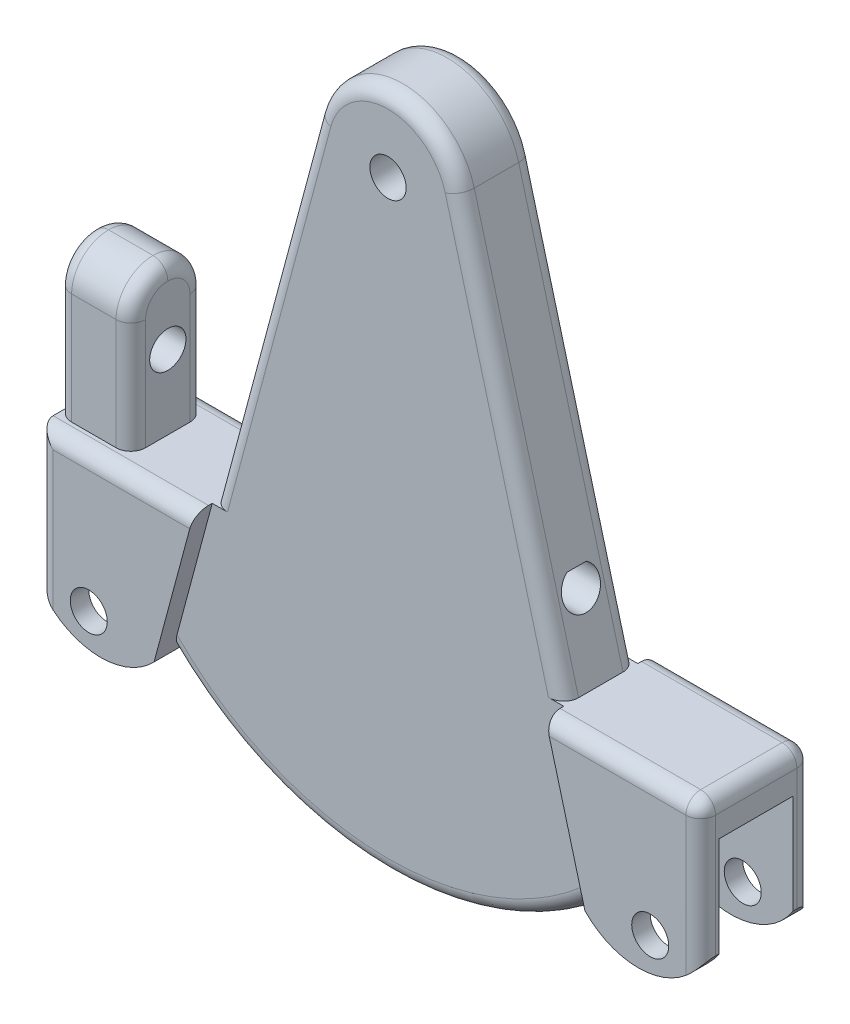
from build123d import *

# Parameters (mm, degrees)
SKETCH2_R           = 3.1115
BOSS_EXTRUDE1_DEPTH = 6.35
SKETCH3_R           = 3.1115
CUT_EXTRUDE1_DEPTH  = 12.7
CUT_EXTRUDE3_DEPTH  = 121.606183935
SKETCH9_R           = 3.175
BOSS_EXTRUDE2_DEPTH = 3.175
FILLET1_R           = 6.35
FILLET2_R           = 2.54


# Some blends are built 0.0001 mm under size
with BuildPart() as part:
    # Sketch2 → Boss-Extrude1 (new, symmetric)
    with BuildSketch(Plane.XY):
        with BuildLine():
            Line((26.67, -25.4), (44.565523217, 41.387001873))
            ThreePointArc((44.565523217, 41.387001873), (56.832781211, 50.8), (69.100039204, 41.387001873))
            Line((69.100039204, 41.387001873), (86.995562421, -25.4))
            Line((86.995562421, -25.4), (113.665562421, -25.4))
            Line((113.665562421, -25.4), (113.665562421, -31.75))
            Line((113.665562421, -31.75), (93.801471909, -50.8))
            ThreePointArc((93.801471909, -50.8), (56.832781211, -65.661893883), (19.864090512, -50.8))
            Line((19.864090512, -50.8), (0, -31.75))
            Line((0, -31.75), (0, 0))
            Line((0, 0), (12.7, 0))
            Line((12.7, 0), (12.7, -25.4))
            Line((12.7, -25.4), (26.67, -25.4))
        make_face()
        with Locations((56.832781211, 38.1)):
            Circle(SKETCH2_R, mode=Mode.SUBTRACT)
    extrude(amount=BOSS_EXTRUDE1_DEPTH, both=True)

    # Sketch3 → Cut-Extrude1 (cut)
    with BuildSketch(Plane.ZY):
        with Locations(Location((0, -12.7, 0), (0, 0, 270))):
            Circle(SKETCH3_R)
    extrude(amount=-CUT_EXTRUDE1_DEPTH, mode=Mode.SUBTRACT)

    # Sketch5 → Cut-Extrude3 (cut, through all)
    with BuildSketch(Plane(origin=(12.7, 0, 0), x_dir=(0, 0, -1), z_dir=(1, 0, 0))):
        with BuildLine():
            Line((1.651, -9.913948807), (-1.651, -9.913948807))
            ThreePointArc((-1.651, -9.913948807), (0, -15.9385), (1.651, -9.913948807))
        make_face()
    extrude(amount=CUT_EXTRUDE3_DEPTH, mode=Mode.SUBTRACT)

    # Sketch9 → Boss-Extrude2 (add)
    # profile 1 of 2: a face of its own
    with BuildSketch(Plane.XY.offset(6.35)):
        with BuildLine():
            Line((26.67, -25.4), (19.864090512, -50.8))
            ThreePointArc((19.864090512, -50.8), (9.459583385, -54.649013668), (0, -48.8537607))
            Line((0, -48.8537607), (0, -25.4))
            Line((0, -25.4), (26.67, -25.4))
        make_face()
        with Locations((8.660533834, -48.8537607)):
            Circle(SKETCH9_R, mode=Mode.SUBTRACT)
    # profile 2 of 2: a face of its own
    with BuildSketch(Plane.XY.offset(6.35)):
        with BuildLine():
            Line((113.665562421, -25.4), (86.995562421, -25.4))
            Line((86.995562421, -25.4), (93.801471909, -50.8))
            ThreePointArc((93.801471909, -50.8), (104.205979036, -54.649013668), (113.665562421, -48.8537607))
            Line((113.665562421, -48.8537607), (113.665562421, -25.4))
        make_face()
        with Locations(Location((105.005028588, -48.8537607, 0), (0, 0, 180))):
            Circle(SKETCH9_R, mode=Mode.SUBTRACT)
    boss_extrude2 = extrude(amount=BOSS_EXTRUDE2_DEPTH)

    # Mirror4: Boss-Extrude2 across plane
    add(boss_extrude2.mirror(Plane.XY))

    # Fillet1
    fillet1_edges = [part.edges().sort_by_distance(p)[0] for p in [
        (6.35, 0, -6.35),
        (6.35, 0, 6.35),
    ]]
    fillet(fillet1_edges, radius=FILLET1_R - 0.0001)  # a hair under: the kernel refuses the full size

    # Fillet2
    # the kernel refuses this fillet: 2.54 mm, written as the material it takes off along each edge
    with BuildSketch(Plane(origin=(111.125562421, -27.94, 6.985), x_dir=(0, 0, 1), z_dir=(0, 1, 0))) as fillet2_piece_1_section:
        Polygon((0, 0), (FILLET2_R * 1.02, 0), (FILLET2_R * 1.02, FILLET2_R * 1.02), (0, FILLET2_R * 1.02), align=None)
    fillet2_piece_1 = extrude(amount=FILLET2_R * 1.02, mode=Mode.PRIVATE)
    fillet2_piece_1 = fillet2_piece_1 - Plane(origin=(111.125562421, -27.94, 6.985), x_dir=(-0.7071067811865475, 0, -0.7071067811865475), z_dir=(0, 1, 0)) * Sphere(FILLET2_R, mode=Mode.PRIVATE)
    add(fillet2_piece_1, mode=Mode.SUBTRACT)
    with BuildSketch(Plane(origin=(111.125562421, -27.94, -6.985), x_dir=(0, 0, -1), z_dir=(0, 1, 0))) as fillet2_piece_2_section:
        Polygon((0, 0), (FILLET2_R * 1.02, 0), (FILLET2_R * 1.02, -FILLET2_R * 1.02), (0, -FILLET2_R * 1.02), align=None)
    fillet2_piece_2 = extrude(amount=FILLET2_R * 1.02, mode=Mode.PRIVATE)
    fillet2_piece_2 = fillet2_piece_2 - Plane(origin=(111.125562421, -27.94, -6.985), x_dir=(-0.7071067811865475, 0, 0.7071067811865475), z_dir=(0, 1, 0)) * Sphere(FILLET2_R, mode=Mode.PRIVATE)
    add(fillet2_piece_2, mode=Mode.SUBTRACT)
    with BuildSketch(Plane(origin=(12.7, -6.3499, -6.35), x_dir=(-1, 0, 0), z_dir=(0, -1, 0)), Plane(origin=(12.7, -6.3499, 6.35), x_dir=(0, 0, -1), z_dir=(0, -1, 0)), Plane(origin=(0, -25.4, 6.35), x_dir=(0, 0, -1), z_dir=(0, 1, 0)), Plane(origin=(0, -25.4, -6.35), x_dir=(1, 0, 0), z_dir=(0, 1, 0))) as fillet2_piece_3:
        with BuildLine():
            CenterArc((FILLET2_R, -FILLET2_R), FILLET2_R, 90, 90)
            Line((0, -FILLET2_R), (0, 0))
            Line((0, 0), (FILLET2_R, 0))
        make_face()
    extrude(amount=19.0501, mode=Mode.SUBTRACT)
    with BuildSketch(Plane(origin=(12.7, -6.3499, 0.0001), x_dir=(0, 1, 0), z_dir=(0, 0, -1))) as fillet2_piece_4:
        with BuildLine():
            CenterArc((6.3499 - FILLET2_R, -FILLET2_R), FILLET2_R, 0, 90)
            Line((6.3499, -FILLET2_R), (6.3499, 0))
            Line((6.3499, 0), (6.3499 - FILLET2_R, 0))
        make_face()
    revolve(axis=Axis((12.7, -6.3499, 0.0001), (1, 0, 0)), revolution_arc=90, mode=Mode.SUBTRACT)
    with BuildSketch(Plane(origin=(0, -6.3499, 0.0001), x_dir=(0, 1, 0), z_dir=(0, 0, -1))) as fillet2_piece_5:
        with BuildLine():
            CenterArc((6.3499 - FILLET2_R, FILLET2_R), FILLET2_R, 270, 90)
            Line((6.3499, FILLET2_R), (6.3499, 0))
            Line((6.3499, 0), (6.3499 - FILLET2_R, 0))
        make_face()
    revolve(axis=Axis((0, -6.3499, 0.0001), (1, 0, 0)), revolution_arc=90, mode=Mode.SUBTRACT)
    with BuildSketch(Plane(origin=(0, -6.3499, -0.0001), x_dir=(0, 0, -1), z_dir=(0, -1, 0))) as fillet2_piece_6:
        with BuildLine():
            CenterArc((6.3499 - FILLET2_R, FILLET2_R), FILLET2_R, 270, 90)
            Line((6.3499 - FILLET2_R, 0), (6.3499, 0))
            Line((6.3499, 0), (6.3499, FILLET2_R))
        make_face()
    revolve(axis=Axis((0, -6.3499, -0.0001), (1, 0, 0)), revolution_arc=90, mode=Mode.SUBTRACT)
    with BuildSketch(Plane(origin=(69.100039204, 41.387001873, -6.35), x_dir=(-0.9659258262890682, -0.2588190451025212, 0), z_dir=(0.2588190451025212, -0.9659258262890682, 0))) as fillet2_piece_7_section:
        with BuildLine():
            CenterArc((FILLET2_R, -FILLET2_R), FILLET2_R, 90, 90)
            Line((0, -FILLET2_R), (0, 0))
            Line((0, 0), (FILLET2_R, 0))
        make_face()
    fillet2_piece_7 = extrude(amount=75.4929922, mode=Mode.PRIVATE)
    fillet2_piece_7 = split(fillet2_piece_7, bisect_by=Plane(origin=(68.876104446, -25.4, -5.922360924), z_dir=(0, 1, 0)), keep=Keep.TOP, mode=Mode.PRIVATE)
    add(fillet2_piece_7, mode=Mode.SUBTRACT)
    with BuildSketch(Plane(origin=(56.832781211, 38.1, -6.35), x_dir=(-0.9659258262890699, 0.2588190451025148, 0), z_dir=(-0.2588190451025148, -0.9659258262890699, 0))) as fillet2_piece_8:
        with BuildLine():
            CenterArc((12.7 - FILLET2_R, -FILLET2_R), FILLET2_R, 0, 90)
            Line((12.7, -FILLET2_R), (12.7, 0))
            Line((12.7, 0), (12.7 - FILLET2_R, 0))
        make_face()
    revolve(axis=Axis((56.832781211, 38.1, -6.35), (0, 0, -1)), revolution_arc=150, mode=Mode.SUBTRACT)
    with BuildSketch(Plane(origin=(69.100039204, 41.387001873, 6.35), x_dir=(-0.9659258262890682, -0.2588190451025212, 0), z_dir=(0.2588190451025212, -0.9659258262890682, 0))) as fillet2_piece_9_section:
        with BuildLine():
            CenterArc((FILLET2_R, FILLET2_R), FILLET2_R, 180, 90)
            Line((0, FILLET2_R), (0, 0))
            Line((0, 0), (FILLET2_R, 0))
        make_face()
    fillet2_piece_9 = extrude(amount=75.4929922, mode=Mode.PRIVATE)
    fillet2_piece_9 = split(fillet2_piece_9, bisect_by=Plane(origin=(68.876104446, -25.4, 5.922360924), z_dir=(0, 1, 0)), keep=Keep.TOP, mode=Mode.PRIVATE)
    add(fillet2_piece_9, mode=Mode.SUBTRACT)
    with BuildSketch(Plane(origin=(56.832781211, 38.1, 6.35), x_dir=(-0.9659258262890699, 0.2588190451025148, 0), z_dir=(-0.2588190451025148, -0.9659258262890699, 0))) as fillet2_piece_10:
        with BuildLine():
            CenterArc((12.7 - FILLET2_R, FILLET2_R), FILLET2_R, 270, 90)
            Line((12.7 - FILLET2_R, 0), (12.7, 0))
            Line((12.7, 0), (12.7, FILLET2_R))
        make_face()
    revolve(axis=Axis((56.832781211, 38.1, 6.35), (0, 0, -1)), revolution_arc=150, mode=Mode.SUBTRACT)
    with BuildSketch(Plane(origin=(113.665562421, -55.2037607, 9.525), x_dir=(-1, 0, 0), z_dir=(0, 1, 0))) as fillet2_piece_11:
        with BuildLine():
            CenterArc((FILLET2_R, -FILLET2_R), FILLET2_R, 90, 90)
            Line((0, -FILLET2_R), (0, 0))
            Line((0, 0), (FILLET2_R, 0))
        make_face()
    extrude(amount=27.2637607, mode=Mode.SUBTRACT)
    with BuildSketch(Plane(origin=(113.665562421, -55.2037607, -9.525), x_dir=(-1, 0, 0), z_dir=(0, 1, 0))) as fillet2_piece_12:
        with BuildLine():
            CenterArc((FILLET2_R, FILLET2_R), FILLET2_R, 180, 90)
            Line((0, FILLET2_R), (0, 0))
            Line((0, 0), (FILLET2_R, 0))
        make_face()
    extrude(amount=27.2637607, mode=Mode.SUBTRACT)
    with BuildSketch(Plane(origin=(0, -31.75, 6.35), x_dir=(0, 1, 0), z_dir=(0, 0, -1))) as fillet2_piece_13:
        with BuildLine():
            CenterArc((FILLET2_R * 0.426520306378, FILLET2_R), FILLET2_R, 223.801535716, 46.198464284)
            Line((-FILLET2_R * 0.295221369742, FILLET2_R * 0.307837480825), (0, 0))
            Line((0, 0), (FILLET2_R * 0.426520306378, 0))
        make_face()
    extrude(amount=12.7, mode=Mode.SUBTRACT)
    with BuildSketch(Plane(origin=(0, -55.2037607, -9.525), x_dir=(0, 0, 1), z_dir=(0, 1, 0))) as fillet2_piece_14:
        with BuildLine():
            CenterArc((FILLET2_R, FILLET2_R), FILLET2_R, 180, 90)
            Line((0, FILLET2_R), (0, 0))
            Line((0, 0), (FILLET2_R, 0))
        make_face()
    extrude(amount=36.1537607, mode=Mode.SUBTRACT)
    with BuildSketch(Plane(origin=(0, -55.2037607, 9.525), x_dir=(0, 0, -1), z_dir=(0, 1, 0))) as fillet2_piece_15:
        with BuildLine():
            CenterArc((FILLET2_R, -FILLET2_R), FILLET2_R, 90, 90)
            Line((0, -FILLET2_R), (0, 0))
            Line((0, 0), (FILLET2_R, 0))
        make_face()
    extrude(amount=36.1537607, mode=Mode.SUBTRACT)
    with BuildSketch(Plane(origin=(56.832781211, -12.251474113, -6.35), x_dir=(0.7729114718935509, -0.6345138742496845, 0), z_dir=(0.6345138742496845, 0.7729114718935509, 0))) as fillet2_piece_16_section:
        with BuildLine():
            CenterArc((53.41041977 - FILLET2_R, -FILLET2_R), FILLET2_R, 0, 90)
            Line((53.41041977, -FILLET2_R), (53.41041977, 0))
            Line((53.41041977, 0), (53.41041977 - FILLET2_R, 0))
        make_face()
    fillet2_piece_16 = revolve(axis=Axis((56.832781211, -12.251474113, -6.35), (0, 0, -1)), revolution_arc=101.232122505, mode=Mode.PRIVATE)
    fillet2_piece_16 = split(fillet2_piece_16, bisect_by=Plane(origin=(25.007151117, -31.605836517, -6.009871091), z_dir=(0.9659258262890701, -0.2588190451025142, 0)), keep=Keep.TOP, mode=Mode.PRIVATE)
    fillet2_piece_16 = split(fillet2_piece_16, bisect_by=Plane(origin=(93.550754109, -49.864308433, -6.009871091), z_dir=(-0.96592582628907, -0.2588190451025145, 0)), keep=Keep.TOP, mode=Mode.PRIVATE)
    add(fillet2_piece_16, mode=Mode.SUBTRACT)
    with BuildSketch(Plane(origin=(56.832781211, -12.251474113, 6.35), x_dir=(0.7729114718935509, -0.6345138742496845, 0), z_dir=(0.6345138742496845, 0.7729114718935509, 0))) as fillet2_piece_17_section:
        with BuildLine():
            CenterArc((53.41041977 - FILLET2_R, FILLET2_R), FILLET2_R, 270, 90)
            Line((53.41041977, FILLET2_R), (53.41041977, 0))
            Line((53.41041977, 0), (53.41041977 - FILLET2_R, 0))
        make_face()
    fillet2_piece_17 = revolve(axis=Axis((56.832781211, -12.251474113, 6.35), (0, 0, -1)), revolution_arc=101.232122505, mode=Mode.PRIVATE)
    fillet2_piece_17 = split(fillet2_piece_17, bisect_by=Plane(origin=(25.007151117, -31.605836517, 6.009871091), z_dir=(0.9659258262890701, -0.2588190451025142, 0)), keep=Keep.TOP, mode=Mode.PRIVATE)
    fillet2_piece_17 = split(fillet2_piece_17, bisect_by=Plane(origin=(93.550754109, -49.864308433, 6.009871091), z_dir=(-0.96592582628907, -0.2588190451025145, 0)), keep=Keep.TOP, mode=Mode.PRIVATE)
    add(fillet2_piece_17, mode=Mode.SUBTRACT)
    with BuildSketch(Plane(origin=(111.125562421, -25.4, -9.525), x_dir=(0, 0, 1), z_dir=(-1, 0, 0))) as fillet2_piece_18:
        with BuildLine():
            CenterArc((FILLET2_R, -FILLET2_R), FILLET2_R, 90, 90)
            Line((0, -FILLET2_R), (0, 0))
            Line((0, 0), (FILLET2_R, 0))
        make_face()
    extrude(amount=30.48, mode=Mode.SUBTRACT)
    with BuildSketch(Plane(origin=(113.665562421, -25.4, -6.985), x_dir=(-1, 0, 0), z_dir=(0, 0, 1))) as fillet2_piece_19:
        with BuildLine():
            CenterArc((FILLET2_R, FILLET2_R), FILLET2_R, 180, 90)
            Line((0, FILLET2_R), (0, 0))
            Line((0, 0), (FILLET2_R, 0))
        make_face()
    extrude(amount=13.97, mode=Mode.SUBTRACT)
    with BuildSketch(Plane(origin=(111.125562421, -25.4, 9.525), x_dir=(0, 0, -1), z_dir=(-1, 0, 0))) as fillet2_piece_20:
        with BuildLine():
            CenterArc((FILLET2_R, FILLET2_R), FILLET2_R, 180, 90)
            Line((0, FILLET2_R), (0, 0))
            Line((0, 0), (FILLET2_R, 0))
        make_face()
    extrude(amount=30.48, mode=Mode.SUBTRACT)
    with BuildSketch(Plane(origin=(12.7, -6.3499, -0.0001), x_dir=(0, 0, -1), z_dir=(0, -1, 0))) as fillet2_piece_21:
        with BuildLine():
            CenterArc((6.3499 - FILLET2_R, -FILLET2_R), FILLET2_R, 0, 90)
            Line((6.3499, -FILLET2_R), (6.3499, 0))
            Line((6.3499, 0), (6.3499 - FILLET2_R, 0))
        make_face()
    revolve(axis=Axis((12.7, -6.3499, -0.0001), (1, 0, 0)), revolution_arc=90, mode=Mode.SUBTRACT)
    with BuildSketch(Plane(origin=(-6.35, -25.4, -9.525), x_dir=(0, 0, 1), z_dir=(1, 0, 0))) as fillet2_piece_22:
        with BuildLine():
            CenterArc((FILLET2_R, FILLET2_R), FILLET2_R, 180, 90)
            Line((0, FILLET2_R), (0, 0))
            Line((0, 0), (FILLET2_R, 0))
        make_face()
    extrude(amount=39.37, mode=Mode.SUBTRACT)
    with BuildSketch(Plane(origin=(-6.35, -25.4, 9.525), x_dir=(0, 0, -1), z_dir=(1, 0, 0))) as fillet2_piece_23:
        with BuildLine():
            CenterArc((FILLET2_R, -FILLET2_R), FILLET2_R, 90, 90)
            Line((0, -FILLET2_R), (0, 0))
            Line((0, 0), (FILLET2_R, 0))
        make_face()
    extrude(amount=39.37, mode=Mode.SUBTRACT)
    with BuildSketch(Plane(origin=(25.026499064, -31.533628997, -6.35), x_dir=(0, 0, 1), z_dir=(0.25881904510251397, 0.9659258262890701, 0))) as fillet2_piece_24_section:
        with BuildLine():
            CenterArc((FILLET2_R, FILLET2_R), FILLET2_R, 180, 90)
            Line((0, FILLET2_R), (0, 0))
            Line((0, 0), (FILLET2_R, 0))
        make_face()
    fillet2_piece_24 = extrude(amount=75.4929922, mode=Mode.PRIVATE)
    fillet2_piece_24 = split(fillet2_piece_24, bisect_by=Plane(origin=(35.742506372, -25.4, -5.774922741), z_dir=(0, 1, 0)), keep=Keep.TOP, mode=Mode.PRIVATE)
    add(fillet2_piece_24, mode=Mode.SUBTRACT)
    with BuildSketch(Plane(origin=(25.026499064, -31.533628997, 6.35), x_dir=(0, 0, -1), z_dir=(0.25881904510251397, 0.9659258262890701, 0))) as fillet2_piece_25_section:
        with BuildLine():
            CenterArc((FILLET2_R, -FILLET2_R), FILLET2_R, 90, 90)
            Line((0, -FILLET2_R), (0, 0))
            Line((0, 0), (FILLET2_R, 0))
        make_face()
    fillet2_piece_25 = extrude(amount=75.4929922, mode=Mode.PRIVATE)
    fillet2_piece_25 = split(fillet2_piece_25, bisect_by=Plane(origin=(35.742506372, -25.4, 5.774922741), z_dir=(0, 1, 0)), keep=Keep.TOP, mode=Mode.PRIVATE)
    add(fillet2_piece_25, mode=Mode.SUBTRACT)
    with BuildSketch(Plane(origin=(12.7, 0, 0.0001), x_dir=(0, -1, 0), z_dir=(0, 0, -1))) as fillet2_piece_26:
        with BuildLine():
            CenterArc((FILLET2_R, FILLET2_R), FILLET2_R, 180, 90)
            Line((0, FILLET2_R), (0, 0))
            Line((0, 0), (FILLET2_R, 0))
        make_face()
    extrude(amount=0.0002, mode=Mode.SUBTRACT)
    with BuildSketch(Plane(origin=(0, 0, 0.0001), x_dir=(0, -1, 0), z_dir=(0, 0, -1))) as fillet2_piece_27:
        with BuildLine():
            CenterArc((FILLET2_R, -FILLET2_R), FILLET2_R, 90, 90)
            Line((0, -FILLET2_R), (0, 0))
            Line((0, 0), (FILLET2_R, 0))
        make_face()
    extrude(amount=0.0002, mode=Mode.SUBTRACT)


solid = part.part
